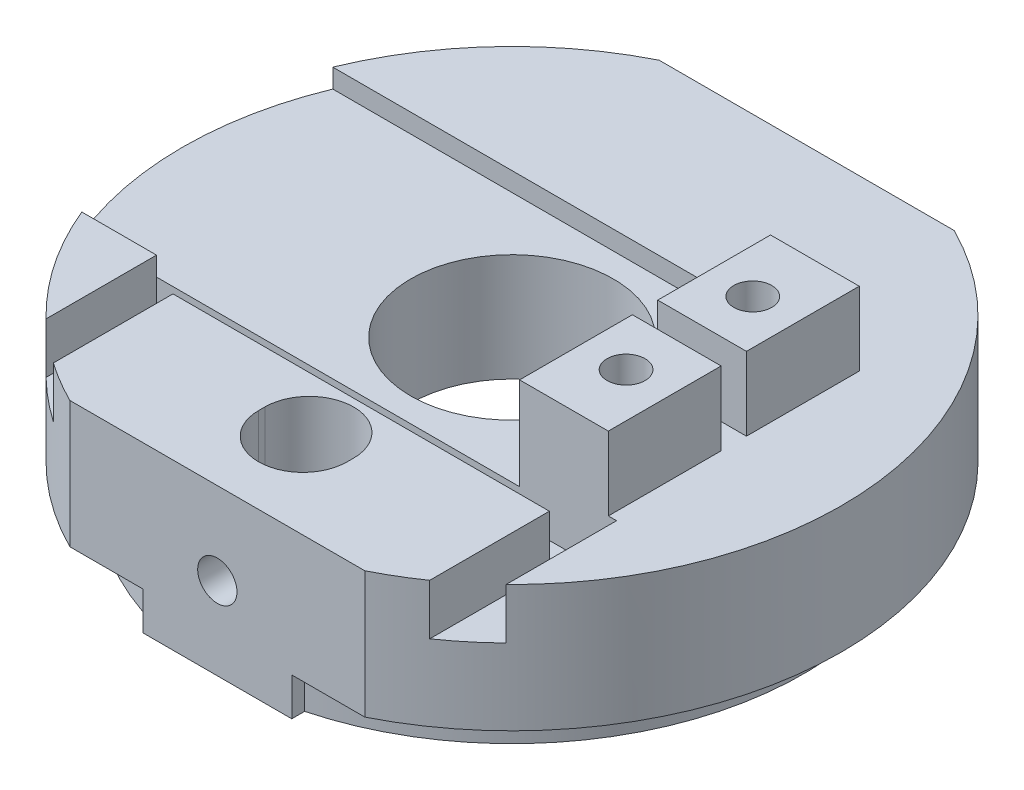
from build123d import *

# Parameters (mm, degrees)
SKETCH1_R           = 8
BOSS_EXTRUDE1_DEPTH = 10
SKETCH1_3_R         = 21
BOSS_EXTRUDE2_DEPTH = 3
CUT_EXTRUDE1_DEPTH  = 4
SKETCH3_W           = 36.5
SKETCH3_H           = 19.8
CUT_EXTRUDE2_DEPTH  = 1.5
SKETCH4_W           = 7
SKETCH4_H           = 8.9
SKETCH4_R           = 1.5
BOSS_EXTRUDE3_DEPTH = 5.8
SKETCH5_R           = 1.55
CUT_EXTRUDE3_DEPTH  = 6


with BuildPart() as part:
    # Sketch1 → Boss-Extrude1 (new body)
    with BuildSketch(Plane(origin=(0, 0, 0), x_dir=(1, 0, 0), z_dir=(0, 1, 0))):
        with BuildLine():
            ThreePointArc((-11.637761812, 23.25), (-26, 0), (-11.637761812, -23.25))
            Line((-11.637761812, -23.25), (11.637761812, -23.25))
            ThreePointArc((11.637761812, -23.25), (26, 0), (11.637761812, 23.25))
            Line((11.637761812, 23.25), (-11.637761812, 23.25))
        make_face()
        Circle(SKETCH1_R, mode=Mode.SUBTRACT)
        with BuildLine():
            ThreePointArc((-3.5, -16), (0, -12.5), (3.5, -16))
            Line((3.5, -16), (3.5, -16.5))
            ThreePointArc((3.5, -16.5), (0, -20), (-3.5, -16.5))
            Line((-3.5, -16.5), (-3.5, -16))
        make_face(mode=Mode.SUBTRACT)
    extrude(amount=BOSS_EXTRUDE1_DEPTH)

    # Sketch1<3> → Boss-Extrude2 (add)
    with BuildSketch(Plane(origin=(0, 0, 0), x_dir=(1, 0, 0), z_dir=(0, 1, 0))):
        with BuildLine():
            Line((-5.874521255, -22.23713111), (-5.874521255, -23.25))
            Line((-5.874521255, -23.25), (5.874521255, -23.25))
            Line((5.874521255, -23.25), (5.874521255, -22.23713111))
            ThreePointArc((5.874521255, -22.23713111), (0, 23), (-5.874521255, -22.23713111))
        make_face()
        Circle(SKETCH1_3_R, mode=Mode.SUBTRACT)
    extrude(amount=-BOSS_EXTRUDE2_DEPTH)

    # Sketch2 → Cut-Extrude1 (cut)
    with BuildSketch(Plane(origin=(0, 10, 0), x_dir=(1, 0, 0), z_dir=(0, 1, 0))):
        Polygon((-18.15, -9.9), (-18.15, -23.25), (-14.85, -23.25), (-14.85, -11.9), (14.85, -11.9), (14.85, -23.25), (18.15, -23.25), (18.15, -9.9), align=None)
    extrude(amount=-CUT_EXTRUDE1_DEPTH, mode=Mode.SUBTRACT)

    # Sketch3 → Cut-Extrude2 (cut)
    with BuildSketch(Plane(origin=(0, 10, 0), x_dir=(1, 0, 0), z_dir=(0, 1, 0))):
        with Locations((-7.75, 0)):
            Rectangle(SKETCH3_W, SKETCH3_H)
    extrude(amount=-CUT_EXTRUDE2_DEPTH, mode=Mode.SUBTRACT)

    # Sketch4 → Boss-Extrude3 (add)
    # profile 1 of 2: a face of its own
    with BuildSketch(Plane(origin=(0, 10, 0), x_dir=(1, 0, 0), z_dir=(0, 1, 0))):
        with Locations((14, 5.45)):
            Rectangle(SKETCH4_W, SKETCH4_H)
        with Locations((14, 5)):
            Circle(SKETCH4_R, mode=Mode.SUBTRACT)
    # profile 2 of 2: a face of its own
    with BuildSketch(Plane(origin=(0, 10, 0), x_dir=(1, 0, 0), z_dir=(0, 1, 0))):
        with Locations((14, -5.45)):
            Rectangle(SKETCH4_W, SKETCH4_H)
        with Locations((14, -5)):
            Circle(SKETCH4_R, mode=Mode.SUBTRACT)
    extrude(amount=BOSS_EXTRUDE3_DEPTH)

    # Sketch5 → Cut-Extrude3 (cut)
    with BuildSketch(Plane.XY.offset(23.25)):
        with Locations((0, 3.5)):
            Circle(SKETCH5_R)
    extrude(amount=-CUT_EXTRUDE3_DEPTH, mode=Mode.SUBTRACT)


solid = part.part
